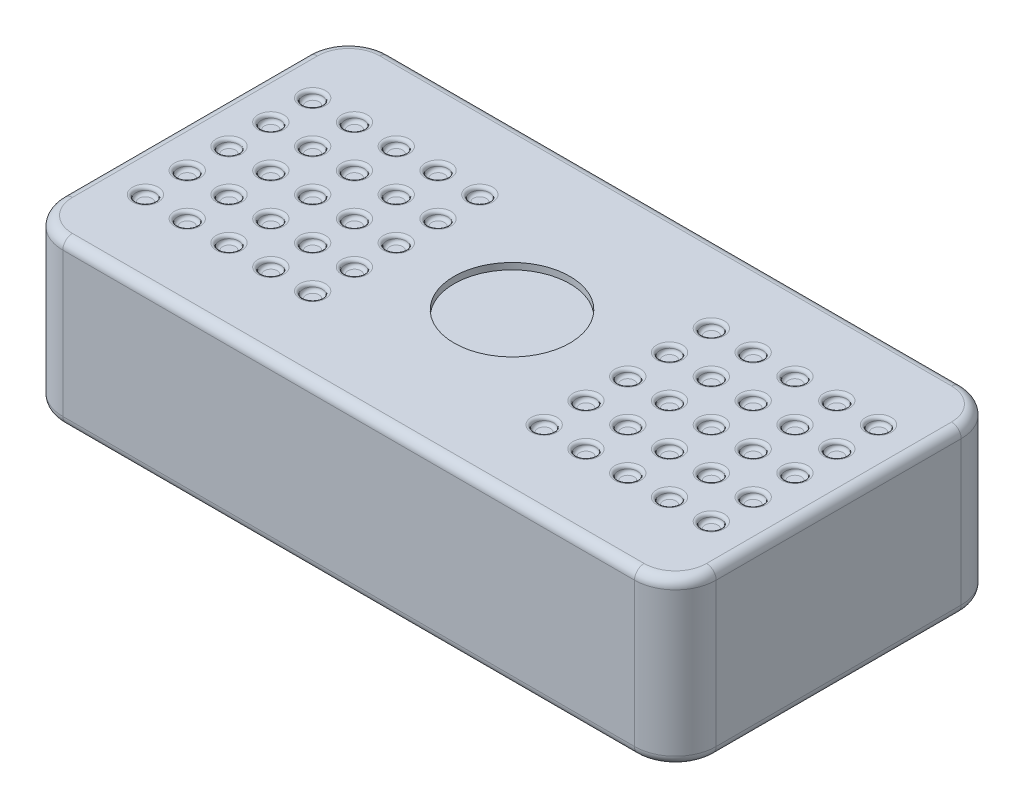
from build123d import *

# Parameters (mm, degrees)
BOSS_EXTRUDE1_DEPTH  = 12.7
SKETCH3_R            = 4.5
CUT_EXTRUDE1_DEPTH   = 0.5
SKETCH2_R            = 0.75
CUT_EXTRUDE2_DEPTH   = 0.5
FILLET1_R            = 0.25
FILLET1_OF_MIRROR1_R = 0.25
FILLET2_R            = 0.75


# Read off the part's stored shape, not the designer's step: CrvPattern1
# Some blends are built 0.0001 mm under size
with BuildPart() as part:
    # Sketch1 → Boss-Extrude1 (new body)
    with BuildSketch(Plane(origin=(0, 0, 0), x_dir=(1, 0, 0), z_dir=(0, 1, 0))):
        with BuildLine():
            Line((22.225, -12.7), (-22.225, -12.7))
            ThreePointArc((-22.225, -12.7), (-24.47006403, -11.77006403), (-25.4, -9.525))
            Line((-25.4, -9.525), (-25.4, 9.525))
            ThreePointArc((-25.4, 9.525), (-24.47006403, 11.77006403), (-22.225, 12.7))
            Line((-22.225, 12.7), (22.225, 12.7))
            ThreePointArc((22.225, 12.7), (24.47006403, 11.77006403), (25.4, 9.525))
            Line((25.4, 9.525), (25.4, -9.525))
            ThreePointArc((25.4, -9.525), (24.47006403, -11.77006403), (22.225, -12.7))
        make_face()
    extrude(amount=BOSS_EXTRUDE1_DEPTH)

    # Sketch3 → Cut-Extrude1 (cut)
    with BuildSketch(Plane(origin=(0, 12.7, 0), x_dir=(1, 0, 0), z_dir=(0, 1, 0))):
        with Locations(Location((0, 0, 0), (0, 0, 270))):
            Circle(SKETCH3_R)
    extrude(amount=-CUT_EXTRUDE1_DEPTH, mode=Mode.SUBTRACT)

    # Sketch2 → Cut-Extrude2 (cut)
    with BuildSketch(Plane(origin=(0, 12.7, 0), x_dir=(1, 0, 0), z_dir=(0, 1, 0))):
        with Locations(Location((-22, 6.5, 0), (0, 0, 270))):
            Circle(SKETCH2_R)
    cut_extrude2 = extrude(amount=-CUT_EXTRUDE2_DEPTH, mode=Mode.SUBTRACT)

    # Fillet1
    fillet1_edges = [part.edges().sort_by_distance(p)[0] for p in [
        (-22, 12.2, -7.25),
        (-22, 12.7, -7.25),
    ]]
    fillet(fillet1_edges, radius=FILLET1_R - 0.0001)  # a hair under: the kernel refuses the full size

    # CrvPattern1 outline → CrvPattern1 (revolve, cut)
    with BuildSketch(Plane(origin=(-22, 0, -3.25), x_dir=(1, 0, 0), z_dir=(0, 0, 1))):
        with BuildLine():
            Line((0, 12.7), (0, 12.2))
            Line((0, 12.2), (0.5, 12.2))
            ThreePointArc((0.5, 12.2), (0.676776695, 12.273223305), (0.75, 12.45))
            ThreePointArc((0.75, 12.45), (0.823223305, 12.626776695), (1, 12.7))
            Line((1, 12.7), (0, 12.7))
        make_face()
    crvpattern1 = revolve(axis=Axis((-22, 0, -3.25), (0, 1, 0)), mode=Mode.SUBTRACT)

    # CrvPattern1 2 outline → CrvPattern1 2 (revolve, cut)
    with BuildSketch(Plane(origin=(-22, 0, 0), x_dir=(1, 0, 0), z_dir=(0, 0, 1))):
        with BuildLine():
            Line((0, 12.7), (0, 12.2))
            Line((0, 12.2), (0.5, 12.2))
            ThreePointArc((0.5, 12.2), (0.676776695, 12.273223305), (0.75, 12.45))
            ThreePointArc((0.75, 12.45), (0.823223305, 12.626776695), (1, 12.7))
            Line((1, 12.7), (0, 12.7))
        make_face()
    crvpattern1_2 = revolve(axis=Axis((-22, 0, 0), (0, 1, 0)), mode=Mode.SUBTRACT)

    # CrvPattern1 3 outline → CrvPattern1 3 (revolve, cut)
    with BuildSketch(Plane(origin=(-22, 0, 3.25), x_dir=(1, 0, 0), z_dir=(0, 0, 1))):
        with BuildLine():
            Line((0, 12.7), (0, 12.2))
            Line((0, 12.2), (0.5, 12.2))
            ThreePointArc((0.5, 12.2), (0.676776695, 12.273223305), (0.75, 12.45))
            ThreePointArc((0.75, 12.45), (0.823223305, 12.626776695), (1, 12.7))
            Line((1, 12.7), (0, 12.7))
        make_face()
    crvpattern1_3 = revolve(axis=Axis((-22, 0, 3.25), (0, 1, 0)), mode=Mode.SUBTRACT)

    # CrvPattern1 4 outline → CrvPattern1 4 (revolve, cut)
    with BuildSketch(Plane(origin=(-22, 0, 6.5), x_dir=(1, 0, 0), z_dir=(0, 0, 1))):
        with BuildLine():
            Line((0, 12.7), (0, 12.2))
            Line((0, 12.2), (0.5, 12.2))
            ThreePointArc((0.5, 12.2), (0.676776695, 12.273223305), (0.75, 12.45))
            ThreePointArc((0.75, 12.45), (0.823223305, 12.626776695), (1, 12.7))
            Line((1, 12.7), (0, 12.7))
        make_face()
    crvpattern1_4 = revolve(axis=Axis((-22, 0, 6.5), (0, 1, 0)), mode=Mode.SUBTRACT)

    # CrvPattern1 5 outline → CrvPattern1 5 (revolve, cut)
    with BuildSketch(Plane(origin=(-18.75, 0, -6.5), x_dir=(1, 0, 0), z_dir=(0, 0, 1))):
        with BuildLine():
            Line((0, 12.7), (0, 12.2))
            Line((0, 12.2), (0.5, 12.2))
            ThreePointArc((0.5, 12.2), (0.676776695, 12.273223305), (0.75, 12.45))
            ThreePointArc((0.75, 12.45), (0.823223305, 12.626776695), (1, 12.7))
            Line((1, 12.7), (0, 12.7))
        make_face()
    crvpattern1_5 = revolve(axis=Axis((-18.75, 0, -6.5), (0, 1, 0)), mode=Mode.SUBTRACT)

    # CrvPattern1 6 outline → CrvPattern1 6 (revolve, cut)
    with BuildSketch(Plane(origin=(-18.75, 0, -3.25), x_dir=(1, 0, 0), z_dir=(0, 0, 1))):
        with BuildLine():
            Line((0, 12.7), (0, 12.2))
            Line((0, 12.2), (0.5, 12.2))
            ThreePointArc((0.5, 12.2), (0.676776695, 12.273223305), (0.75, 12.45))
            ThreePointArc((0.75, 12.45), (0.823223305, 12.626776695), (1, 12.7))
            Line((1, 12.7), (0, 12.7))
        make_face()
    crvpattern1_6 = revolve(axis=Axis((-18.75, 0, -3.25), (0, 1, 0)), mode=Mode.SUBTRACT)

    # CrvPattern1 7 outline → CrvPattern1 7 (revolve, cut)
    with BuildSketch(Plane(origin=(-18.75, 0, 0), x_dir=(1, 0, 0), z_dir=(0, 0, 1))):
        with BuildLine():
            Line((0, 12.7), (0, 12.2))
            Line((0, 12.2), (0.5, 12.2))
            ThreePointArc((0.5, 12.2), (0.676776695, 12.273223305), (0.75, 12.45))
            ThreePointArc((0.75, 12.45), (0.823223305, 12.626776695), (1, 12.7))
            Line((1, 12.7), (0, 12.7))
        make_face()
    crvpattern1_7 = revolve(axis=Axis((-18.75, 0, 0), (0, 1, 0)), mode=Mode.SUBTRACT)

    # CrvPattern1 8 outline → CrvPattern1 8 (revolve, cut)
    with BuildSketch(Plane(origin=(-18.75, 0, 3.25), x_dir=(1, 0, 0), z_dir=(0, 0, 1))):
        with BuildLine():
            Line((0, 12.7), (0, 12.2))
            Line((0, 12.2), (0.5, 12.2))
            ThreePointArc((0.5, 12.2), (0.676776695, 12.273223305), (0.75, 12.45))
            ThreePointArc((0.75, 12.45), (0.823223305, 12.626776695), (1, 12.7))
            Line((1, 12.7), (0, 12.7))
        make_face()
    crvpattern1_8 = revolve(axis=Axis((-18.75, 0, 3.25), (0, 1, 0)), mode=Mode.SUBTRACT)

    # CrvPattern1 9 outline → CrvPattern1 9 (revolve, cut)
    with BuildSketch(Plane(origin=(-18.75, 0, 6.5), x_dir=(1, 0, 0), z_dir=(0, 0, 1))):
        with BuildLine():
            Line((0, 12.7), (0, 12.2))
            Line((0, 12.2), (0.5, 12.2))
            ThreePointArc((0.5, 12.2), (0.676776695, 12.273223305), (0.75, 12.45))
            ThreePointArc((0.75, 12.45), (0.823223305, 12.626776695), (1, 12.7))
            Line((1, 12.7), (0, 12.7))
        make_face()
    crvpattern1_9 = revolve(axis=Axis((-18.75, 0, 6.5), (0, 1, 0)), mode=Mode.SUBTRACT)

    # CrvPattern1 10 outline → CrvPattern1 10 (revolve, cut)
    with BuildSketch(Plane(origin=(-15.5, 0, -6.5), x_dir=(1, 0, 0), z_dir=(0, 0, 1))):
        with BuildLine():
            Line((0, 12.7), (0, 12.2))
            Line((0, 12.2), (0.5, 12.2))
            ThreePointArc((0.5, 12.2), (0.676776695, 12.273223305), (0.75, 12.45))
            ThreePointArc((0.75, 12.45), (0.823223305, 12.626776695), (1, 12.7))
            Line((1, 12.7), (0, 12.7))
        make_face()
    crvpattern1_10 = revolve(axis=Axis((-15.5, 0, -6.5), (0, 1, 0)), mode=Mode.SUBTRACT)

    # CrvPattern1 11 outline → CrvPattern1 11 (revolve, cut)
    with BuildSketch(Plane(origin=(-15.5, 0, -3.25), x_dir=(1, 0, 0), z_dir=(0, 0, 1))):
        with BuildLine():
            Line((0, 12.7), (0, 12.2))
            Line((0, 12.2), (0.5, 12.2))
            ThreePointArc((0.5, 12.2), (0.676776695, 12.273223305), (0.75, 12.45))
            ThreePointArc((0.75, 12.45), (0.823223305, 12.626776695), (1, 12.7))
            Line((1, 12.7), (0, 12.7))
        make_face()
    crvpattern1_11 = revolve(axis=Axis((-15.5, 0, -3.25), (0, 1, 0)), mode=Mode.SUBTRACT)

    # CrvPattern1 12 outline → CrvPattern1 12 (revolve, cut)
    with BuildSketch(Plane(origin=(-15.5, 0, 0), x_dir=(1, 0, 0), z_dir=(0, 0, 1))):
        with BuildLine():
            Line((0, 12.7), (0, 12.2))
            Line((0, 12.2), (0.5, 12.2))
            ThreePointArc((0.5, 12.2), (0.676776695, 12.273223305), (0.75, 12.45))
            ThreePointArc((0.75, 12.45), (0.823223305, 12.626776695), (1, 12.7))
            Line((1, 12.7), (0, 12.7))
        make_face()
    crvpattern1_12 = revolve(axis=Axis((-15.5, 0, 0), (0, 1, 0)), mode=Mode.SUBTRACT)

    # CrvPattern1 13 outline → CrvPattern1 13 (revolve, cut)
    with BuildSketch(Plane(origin=(-15.5, 0, 3.25), x_dir=(1, 0, 0), z_dir=(0, 0, 1))):
        with BuildLine():
            Line((0, 12.7), (0, 12.2))
            Line((0, 12.2), (0.5, 12.2))
            ThreePointArc((0.5, 12.2), (0.676776695, 12.273223305), (0.75, 12.45))
            ThreePointArc((0.75, 12.45), (0.823223305, 12.626776695), (1, 12.7))
            Line((1, 12.7), (0, 12.7))
        make_face()
    crvpattern1_13 = revolve(axis=Axis((-15.5, 0, 3.25), (0, 1, 0)), mode=Mode.SUBTRACT)

    # CrvPattern1 14 outline → CrvPattern1 14 (revolve, cut)
    with BuildSketch(Plane(origin=(-15.5, 0, 6.5), x_dir=(1, 0, 0), z_dir=(0, 0, 1))):
        with BuildLine():
            Line((0, 12.7), (0, 12.2))
            Line((0, 12.2), (0.5, 12.2))
            ThreePointArc((0.5, 12.2), (0.676776695, 12.273223305), (0.75, 12.45))
            ThreePointArc((0.75, 12.45), (0.823223305, 12.626776695), (1, 12.7))
            Line((1, 12.7), (0, 12.7))
        make_face()
    crvpattern1_14 = revolve(axis=Axis((-15.5, 0, 6.5), (0, 1, 0)), mode=Mode.SUBTRACT)

    # CrvPattern1 15 outline → CrvPattern1 15 (revolve, cut)
    with BuildSketch(Plane(origin=(-12.25, 0, -6.5), x_dir=(1, 0, 0), z_dir=(0, 0, 1))):
        with BuildLine():
            Line((0, 12.7), (0, 12.2))
            Line((0, 12.2), (0.5, 12.2))
            ThreePointArc((0.5, 12.2), (0.676776695, 12.273223305), (0.75, 12.45))
            ThreePointArc((0.75, 12.45), (0.823223305, 12.626776695), (1, 12.7))
            Line((1, 12.7), (0, 12.7))
        make_face()
    crvpattern1_15 = revolve(axis=Axis((-12.25, 0, -6.5), (0, 1, 0)), mode=Mode.SUBTRACT)

    # CrvPattern1 16 outline → CrvPattern1 16 (revolve, cut)
    with BuildSketch(Plane(origin=(-12.25, 0, -3.25), x_dir=(1, 0, 0), z_dir=(0, 0, 1))):
        with BuildLine():
            Line((0, 12.7), (0, 12.2))
            Line((0, 12.2), (0.5, 12.2))
            ThreePointArc((0.5, 12.2), (0.676776695, 12.273223305), (0.75, 12.45))
            ThreePointArc((0.75, 12.45), (0.823223305, 12.626776695), (1, 12.7))
            Line((1, 12.7), (0, 12.7))
        make_face()
    crvpattern1_16 = revolve(axis=Axis((-12.25, 0, -3.25), (0, 1, 0)), mode=Mode.SUBTRACT)

    # CrvPattern1 17 outline → CrvPattern1 17 (revolve, cut)
    with BuildSketch(Plane(origin=(-12.25, 0, 0), x_dir=(1, 0, 0), z_dir=(0, 0, 1))):
        with BuildLine():
            Line((0, 12.7), (0, 12.2))
            Line((0, 12.2), (0.5, 12.2))
            ThreePointArc((0.5, 12.2), (0.676776695, 12.273223305), (0.75, 12.45))
            ThreePointArc((0.75, 12.45), (0.823223305, 12.626776695), (1, 12.7))
            Line((1, 12.7), (0, 12.7))
        make_face()
    crvpattern1_17 = revolve(axis=Axis((-12.25, 0, 0), (0, 1, 0)), mode=Mode.SUBTRACT)

    # CrvPattern1 18 outline → CrvPattern1 18 (revolve, cut)
    with BuildSketch(Plane(origin=(-12.25, 0, 3.25), x_dir=(1, 0, 0), z_dir=(0, 0, 1))):
        with BuildLine():
            Line((0, 12.7), (0, 12.2))
            Line((0, 12.2), (0.5, 12.2))
            ThreePointArc((0.5, 12.2), (0.676776695, 12.273223305), (0.75, 12.45))
            ThreePointArc((0.75, 12.45), (0.823223305, 12.626776695), (1, 12.7))
            Line((1, 12.7), (0, 12.7))
        make_face()
    crvpattern1_18 = revolve(axis=Axis((-12.25, 0, 3.25), (0, 1, 0)), mode=Mode.SUBTRACT)

    # CrvPattern1 19 outline → CrvPattern1 19 (revolve, cut)
    with BuildSketch(Plane(origin=(-12.25, 0, 6.5), x_dir=(1, 0, 0), z_dir=(0, 0, 1))):
        with BuildLine():
            Line((0, 12.7), (0, 12.2))
            Line((0, 12.2), (0.5, 12.2))
            ThreePointArc((0.5, 12.2), (0.676776695, 12.273223305), (0.75, 12.45))
            ThreePointArc((0.75, 12.45), (0.823223305, 12.626776695), (1, 12.7))
            Line((1, 12.7), (0, 12.7))
        make_face()
    crvpattern1_19 = revolve(axis=Axis((-12.25, 0, 6.5), (0, 1, 0)), mode=Mode.SUBTRACT)

    # CrvPattern1 20 outline → CrvPattern1 20 (revolve, cut)
    with BuildSketch(Plane(origin=(-9, 0, -6.5), x_dir=(1, 0, 0), z_dir=(0, 0, 1))):
        with BuildLine():
            Line((0, 12.7), (0, 12.2))
            Line((0, 12.2), (0.5, 12.2))
            ThreePointArc((0.5, 12.2), (0.676776695, 12.273223305), (0.75, 12.45))
            ThreePointArc((0.75, 12.45), (0.823223305, 12.626776695), (1, 12.7))
            Line((1, 12.7), (0, 12.7))
        make_face()
    crvpattern1_20 = revolve(axis=Axis((-9, 0, -6.5), (0, 1, 0)), mode=Mode.SUBTRACT)

    # CrvPattern1 21 outline → CrvPattern1 21 (revolve, cut)
    with BuildSketch(Plane(origin=(-9, 0, -3.25), x_dir=(1, 0, 0), z_dir=(0, 0, 1))):
        with BuildLine():
            Line((0, 12.7), (0, 12.2))
            Line((0, 12.2), (0.5, 12.2))
            ThreePointArc((0.5, 12.2), (0.676776695, 12.273223305), (0.75, 12.45))
            ThreePointArc((0.75, 12.45), (0.823223305, 12.626776695), (1, 12.7))
            Line((1, 12.7), (0, 12.7))
        make_face()
    crvpattern1_21 = revolve(axis=Axis((-9, 0, -3.25), (0, 1, 0)), mode=Mode.SUBTRACT)

    # CrvPattern1 22 outline → CrvPattern1 22 (revolve, cut)
    with BuildSketch(Plane(origin=(-9, 0, 0), x_dir=(1, 0, 0), z_dir=(0, 0, 1))):
        with BuildLine():
            Line((0, 12.7), (0, 12.2))
            Line((0, 12.2), (0.5, 12.2))
            ThreePointArc((0.5, 12.2), (0.676776695, 12.273223305), (0.75, 12.45))
            ThreePointArc((0.75, 12.45), (0.823223305, 12.626776695), (1, 12.7))
            Line((1, 12.7), (0, 12.7))
        make_face()
    crvpattern1_22 = revolve(axis=Axis((-9, 0, 0), (0, 1, 0)), mode=Mode.SUBTRACT)

    # CrvPattern1 23 outline → CrvPattern1 23 (revolve, cut)
    with BuildSketch(Plane(origin=(-9, 0, 3.25), x_dir=(1, 0, 0), z_dir=(0, 0, 1))):
        with BuildLine():
            Line((0, 12.7), (0, 12.2))
            Line((0, 12.2), (0.5, 12.2))
            ThreePointArc((0.5, 12.2), (0.676776695, 12.273223305), (0.75, 12.45))
            ThreePointArc((0.75, 12.45), (0.823223305, 12.626776695), (1, 12.7))
            Line((1, 12.7), (0, 12.7))
        make_face()
    crvpattern1_23 = revolve(axis=Axis((-9, 0, 3.25), (0, 1, 0)), mode=Mode.SUBTRACT)

    # CrvPattern1 24 outline → CrvPattern1 24 (revolve, cut)
    with BuildSketch(Plane(origin=(-9, 0, 6.5), x_dir=(1, 0, 0), z_dir=(0, 0, 1))):
        with BuildLine():
            Line((0, 12.7), (0, 12.2))
            Line((0, 12.2), (0.5, 12.2))
            ThreePointArc((0.5, 12.2), (0.676776695, 12.273223305), (0.75, 12.45))
            ThreePointArc((0.75, 12.45), (0.823223305, 12.626776695), (1, 12.7))
            Line((1, 12.7), (0, 12.7))
        make_face()
    crvpattern1_24 = revolve(axis=Axis((-9, 0, 6.5), (0, 1, 0)), mode=Mode.SUBTRACT)

    # Mirror1: Cut-Extrude2, CrvPattern1, CrvPattern1 2, CrvPattern1 3, CrvPattern1 4, CrvPattern1 5, CrvPattern1 6, CrvPattern1 7, CrvPattern1 8, CrvPattern1 9, CrvPattern1 10, CrvPattern1 11, CrvPattern1 12, CrvPattern1 13, CrvPattern1 14, CrvPattern1 15, CrvPattern1 16, CrvPattern1 17, CrvPattern1 18, CrvPattern1 19, CrvPattern1 20, CrvPattern1 21, CrvPattern1 22, CrvPattern1 23, CrvPattern1 24 across plane
    add(cut_extrude2.mirror(Plane(origin=(0, 0, 0), x_dir=(0, 0, 1), z_dir=(1, 0, 0))), mode=Mode.SUBTRACT)
    add(crvpattern1.mirror(Plane(origin=(0, 0, 0), x_dir=(0, 0, 1), z_dir=(1, 0, 0))), mode=Mode.SUBTRACT)
    add(crvpattern1_2.mirror(Plane(origin=(0, 0, 0), x_dir=(0, 0, 1), z_dir=(1, 0, 0))), mode=Mode.SUBTRACT)
    add(crvpattern1_3.mirror(Plane(origin=(0, 0, 0), x_dir=(0, 0, 1), z_dir=(1, 0, 0))), mode=Mode.SUBTRACT)
    add(crvpattern1_4.mirror(Plane(origin=(0, 0, 0), x_dir=(0, 0, 1), z_dir=(1, 0, 0))), mode=Mode.SUBTRACT)
    add(crvpattern1_5.mirror(Plane(origin=(0, 0, 0), x_dir=(0, 0, 1), z_dir=(1, 0, 0))), mode=Mode.SUBTRACT)
    add(crvpattern1_6.mirror(Plane(origin=(0, 0, 0), x_dir=(0, 0, 1), z_dir=(1, 0, 0))), mode=Mode.SUBTRACT)
    add(crvpattern1_7.mirror(Plane(origin=(0, 0, 0), x_dir=(0, 0, 1), z_dir=(1, 0, 0))), mode=Mode.SUBTRACT)
    add(crvpattern1_8.mirror(Plane(origin=(0, 0, 0), x_dir=(0, 0, 1), z_dir=(1, 0, 0))), mode=Mode.SUBTRACT)
    add(crvpattern1_9.mirror(Plane(origin=(0, 0, 0), x_dir=(0, 0, 1), z_dir=(1, 0, 0))), mode=Mode.SUBTRACT)
    add(crvpattern1_10.mirror(Plane(origin=(0, 0, 0), x_dir=(0, 0, 1), z_dir=(1, 0, 0))), mode=Mode.SUBTRACT)
    add(crvpattern1_11.mirror(Plane(origin=(0, 0, 0), x_dir=(0, 0, 1), z_dir=(1, 0, 0))), mode=Mode.SUBTRACT)
    add(crvpattern1_12.mirror(Plane(origin=(0, 0, 0), x_dir=(0, 0, 1), z_dir=(1, 0, 0))), mode=Mode.SUBTRACT)
    add(crvpattern1_13.mirror(Plane(origin=(0, 0, 0), x_dir=(0, 0, 1), z_dir=(1, 0, 0))), mode=Mode.SUBTRACT)
    add(crvpattern1_14.mirror(Plane(origin=(0, 0, 0), x_dir=(0, 0, 1), z_dir=(1, 0, 0))), mode=Mode.SUBTRACT)
    add(crvpattern1_15.mirror(Plane(origin=(0, 0, 0), x_dir=(0, 0, 1), z_dir=(1, 0, 0))), mode=Mode.SUBTRACT)
    add(crvpattern1_16.mirror(Plane(origin=(0, 0, 0), x_dir=(0, 0, 1), z_dir=(1, 0, 0))), mode=Mode.SUBTRACT)
    add(crvpattern1_17.mirror(Plane(origin=(0, 0, 0), x_dir=(0, 0, 1), z_dir=(1, 0, 0))), mode=Mode.SUBTRACT)
    add(crvpattern1_18.mirror(Plane(origin=(0, 0, 0), x_dir=(0, 0, 1), z_dir=(1, 0, 0))), mode=Mode.SUBTRACT)
    add(crvpattern1_19.mirror(Plane(origin=(0, 0, 0), x_dir=(0, 0, 1), z_dir=(1, 0, 0))), mode=Mode.SUBTRACT)
    add(crvpattern1_20.mirror(Plane(origin=(0, 0, 0), x_dir=(0, 0, 1), z_dir=(1, 0, 0))), mode=Mode.SUBTRACT)
    add(crvpattern1_21.mirror(Plane(origin=(0, 0, 0), x_dir=(0, 0, 1), z_dir=(1, 0, 0))), mode=Mode.SUBTRACT)
    add(crvpattern1_22.mirror(Plane(origin=(0, 0, 0), x_dir=(0, 0, 1), z_dir=(1, 0, 0))), mode=Mode.SUBTRACT)
    add(crvpattern1_23.mirror(Plane(origin=(0, 0, 0), x_dir=(0, 0, 1), z_dir=(1, 0, 0))), mode=Mode.SUBTRACT)
    add(crvpattern1_24.mirror(Plane(origin=(0, 0, 0), x_dir=(0, 0, 1), z_dir=(1, 0, 0))), mode=Mode.SUBTRACT)

    # Fillet1 of Mirror1
    # the kernel refuses this fillet: 0.25 mm, written as the material it adds along each edge
    with BuildSketch(Plane(origin=(22, 12.2, -6.5), x_dir=(0, 0, 1), z_dir=(1, 0, 0))) as fillet1_of_mirror1_piece_1:
        with BuildLine():
            CenterArc((0.75 - FILLET1_OF_MIRROR1_R, -FILLET1_OF_MIRROR1_R), FILLET1_OF_MIRROR1_R, 0, 90)
            Line((0.75 - FILLET1_OF_MIRROR1_R, 0), (0.75 - FILLET1_OF_MIRROR1_R, FILLET1_OF_MIRROR1_R * 0.02))
            Line((0.75 - FILLET1_OF_MIRROR1_R, FILLET1_OF_MIRROR1_R * 0.02), (0.75 + FILLET1_OF_MIRROR1_R * 0.02, FILLET1_OF_MIRROR1_R * 0.02))
            Line((0.75 + FILLET1_OF_MIRROR1_R * 0.02, FILLET1_OF_MIRROR1_R * 0.02), (0.75 + FILLET1_OF_MIRROR1_R * 0.02, -FILLET1_OF_MIRROR1_R))
            Line((0.75 + FILLET1_OF_MIRROR1_R * 0.02, -FILLET1_OF_MIRROR1_R), (0.75, -FILLET1_OF_MIRROR1_R))
        make_face()
    revolve(axis=Axis((22, 12.2, -6.5), (0, -1, 0)))
    # the kernel refuses this fillet: 0.25 mm, written as the material it takes off along each edge
    with BuildSketch(Plane(origin=(22, 12.7, -6.5), x_dir=(0, 0, 1), z_dir=(1, 0, 0))) as fillet1_of_mirror1_2_piece_1:
        with BuildLine():
            CenterArc((0.75 + FILLET1_OF_MIRROR1_R, FILLET1_OF_MIRROR1_R), FILLET1_OF_MIRROR1_R, 180, 90)
            Line((0.75, FILLET1_OF_MIRROR1_R), (0.75 - FILLET1_OF_MIRROR1_R * 0.02, FILLET1_OF_MIRROR1_R))
            Line((0.75 - FILLET1_OF_MIRROR1_R * 0.02, FILLET1_OF_MIRROR1_R), (0.75 - FILLET1_OF_MIRROR1_R * 0.02, -FILLET1_OF_MIRROR1_R * 0.02))
            Line((0.75 - FILLET1_OF_MIRROR1_R * 0.02, -FILLET1_OF_MIRROR1_R * 0.02), (0.75 + FILLET1_OF_MIRROR1_R, -FILLET1_OF_MIRROR1_R * 0.02))
            Line((0.75 + FILLET1_OF_MIRROR1_R, -FILLET1_OF_MIRROR1_R * 0.02), (0.75 + FILLET1_OF_MIRROR1_R, 0))
        make_face()
    revolve(axis=Axis((22, 12.7, -6.5), (0, -1, 0)), mode=Mode.SUBTRACT)

    # Fillet2
    fillet2_edges = [part.edges().sort_by_distance(p)[0] for p in [
        (-24.47006403, 12.7, -11.77006403),
        (0, 0, -12.7),
        (24.47006403, 0, -11.77006403),
        (-25.4, 12.7, 0),
        (-24.47006403, 12.7, 11.77006403),
        (0, 12.7, 12.7),
        (24.47006403, 12.7, 11.77006403),
        (25.4, 12.7, 0),
        (24.47006403, 12.7, -11.77006403),
        (0, 12.7, -12.7),
        (25.4, 0, 0),
        (24.47006403, 0, 11.77006403),
        (0, 0, 12.7),
        (-24.47006403, 0, 11.77006403),
        (-25.4, 0, 0),
        (-24.47006403, 0, -11.77006403),
    ]]
    fillet(fillet2_edges, radius=FILLET2_R)


solid = part.part
